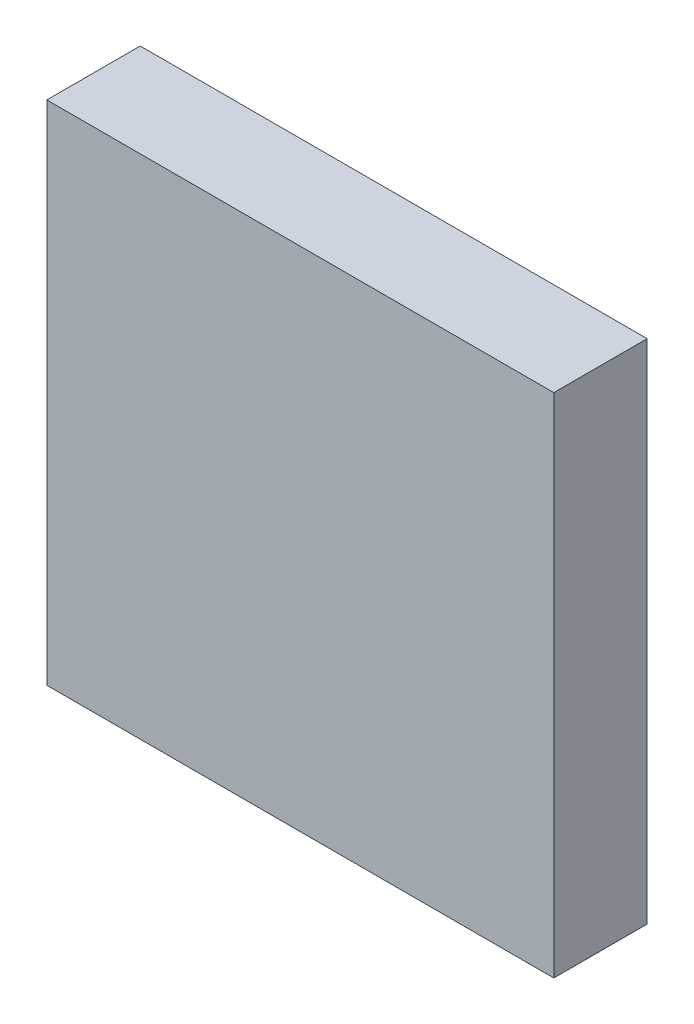
from build123d import *

# Parameters (mm, degrees)
SKETCH1_W           = 38
SKETCH1_H           = 38
BOSS_EXTRUDE1_DEPTH = 7


with BuildPart() as part:
    # Sketch1 → Boss-Extrude1 (new body)
    with BuildSketch(Plane.XY):
        Rectangle(SKETCH1_W, SKETCH1_H)
    extrude(amount=BOSS_EXTRUDE1_DEPTH)


solid = part.part
